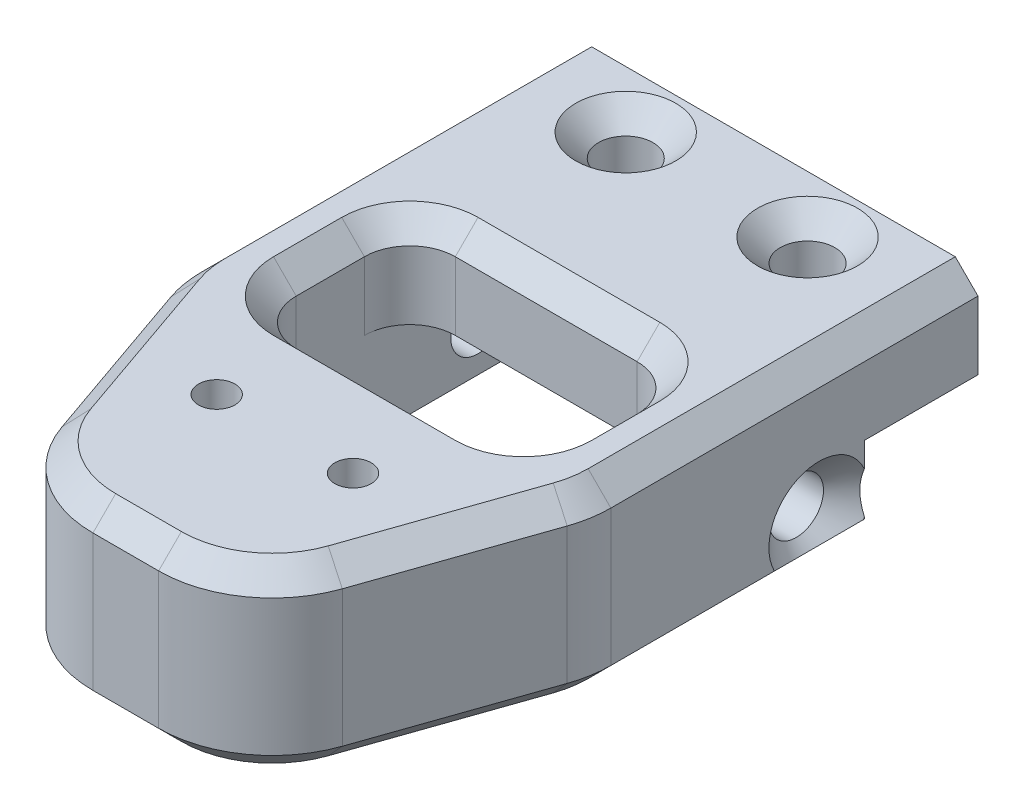
from build123d import *

# Parameters (mm, degrees)
ESBO_O1_W                                            = 18
ESBO_O1_H                                            = 28.5
RESSALTO_EXTRUS_O1_DEPTH                             = 8
ESCAREADO_PARA_PARAFUSO_COM_CABE_A_ESCAR_D           = 2.4
ESCAREADO_PARA_PARAFUSO_COM_CABE_A_ESCAR_CSINK_D     = 4.4
ESCAREADO_PARA_PARAFUSO_COM_CABE_A_ESCAR_CSINK_ANGLE = 90
CORTE_EXTRUS_O1_DEPTH                                = 4
ESCAREADO_PARA_PARAFUSO_COM_CABE_A_E_3_D             = 2.4
ESCAREADO_PARA_PARAFUSO_COM_CABE_A_E_3_CSINK_D       = 4.4
ESCAREADO_PARA_PARAFUSO_COM_CABE_A_E_3_CSINK_ANGLE   = 90
CORTE_EXTRUS_O2_DEPTH                                = 35.644624403
FILETE1_R                                            = 5
CHANFRO1_SIZE                                        = 1
CHANFRO2_SIZE                                        = 1
BROCA_DE_ROSQUEAR_PARA_TARRAXA_DE_M21_D              = 1.6


# Read off the part's stored shape, not the designer's step: Escareado para parafuso com cabeça escareada chata de M21
with BuildPart() as part:
    # Esboço1 → Ressalto-extrusão1 (new body)
    with BuildSketch(Plane(origin=(0, 0, 0), x_dir=(1, 0, 0), z_dir=(0, 1, 0))):
        with Locations((9, 14.25)):
            Rectangle(ESBO_O1_W, ESBO_O1_H)
        with BuildLine():
            Line((5, 11.5), (13, 11.5))
            ThreePointArc((13, 11.5), (14.414213562, 12.085786438), (15, 13.5))
            Line((15, 13.5), (15, 16.5))
            ThreePointArc((15, 16.5), (14.414213562, 17.914213562), (13, 18.5))
            Line((13, 18.5), (5, 18.5))
            ThreePointArc((5, 18.5), (3.585786438, 17.914213562), (3, 16.5))
            Line((3, 16.5), (3, 13.5))
            ThreePointArc((3, 13.5), (3.585786438, 12.085786438), (5, 11.5))
        make_face(mode=Mode.SUBTRACT)
    extrude(amount=RESSALTO_EXTRUS_O1_DEPTH)

    # Escareado para parafuso com cabe_a escar (through all)
    with Locations(Plane(origin=(5, 8, -26), x_dir=(0, 0, 1), z_dir=(0, 1, 0))):
        with Locations((0, 0), (0, 8)):
            CounterSinkHole(ESCAREADO_PARA_PARAFUSO_COM_CABE_A_ESCAR_D / 2, ESCAREADO_PARA_PARAFUSO_COM_CABE_A_ESCAR_CSINK_D / 2, counter_sink_angle=ESCAREADO_PARA_PARAFUSO_COM_CABE_A_ESCAR_CSINK_ANGLE)

    # Esboço10 → Corte-extrusão1 (cut)
    with BuildSketch(Plane.XZ):
        Polygon((0, -28.5), (18, -28.5), (18, -23.5), (15, -23.5), (15, -15), (3, -15), (3, -23.5), (0, -23.5), align=None)
    extrude(amount=-CORTE_EXTRUS_O1_DEPTH, mode=Mode.SUBTRACT)

    # Escareado para parafuso com cabe_a e 2 o → Escareado para parafuso com cabe_a e 2 (revolve, cut)
    with BuildSketch(Plane(origin=(0, 2, -21.5), x_dir=(0, 1, 0), z_dir=(0, 0, -1))):
        Polygon((2.2, 18), (0, 18), (0, 15), (1.2, 15), (1.2, 17), align=None)
    revolve(axis=Axis((0, 2, -21.5), (1, 0, 0)), mode=Mode.SUBTRACT)

    # Escareado para parafuso com cabe_a e 3 (through all)
    with Locations(Plane(origin=(0, 2, -21.5), x_dir=(0, 0, -1), z_dir=(-1, 0, 0))):
        with Locations((0, 0)):
            CounterSinkHole(ESCAREADO_PARA_PARAFUSO_COM_CABE_A_E_3_D / 2, ESCAREADO_PARA_PARAFUSO_COM_CABE_A_E_3_CSINK_D / 2, counter_sink_angle=ESCAREADO_PARA_PARAFUSO_COM_CABE_A_E_3_CSINK_ANGLE)

    # Esboço15 → Corte-extrusão2 (cut, through all)
    with BuildSketch(Plane(origin=(0, 8, 0), x_dir=(1, 0, 0), z_dir=(0, 1, 0))):
        Polygon((0, 0), (4, 0), (0, 11.5), align=None)
        Polygon((18, 0), (18, 11.5), (14, 0), align=None)
    extrude(amount=-CORTE_EXTRUS_O2_DEPTH, mode=Mode.SUBTRACT)

    # Filete1
    filete1_edges = [part.edges().sort_by_distance(p)[0] for p in [
        (0, 4, -11.5),
        (4, 4, 0),
        (14, 4, 0),
        (18, 4, -11.5),
    ]]
    fillet(filete1_edges, radius=FILETE1_R)

    # Chanfro1
    chanfro1_edges = [part.edges().sort_by_distance(p)[0] for p in [
        (16.445137101, 8, -7.029769164),
        (0, 8, -20.422372289),
        (1.554862899, 8, -7.029769164),
        (9, 8, 0),
        (18, 8, -20.422372289),
        (13.342458661, 8, -0.924891681),
        (0.069867146, 8, -11.511803979),
        (4.657541339, 8, -0.924891681),
        (17.930132854, 8, -11.511803979),
        (3.585786438, 8, -12.085786438),
        (14.414213562, 8, -17.914213562),
        (9, 8, -18.5),
        (3.585786438, 8, -17.914213562),
        (3, 8, -15),
        (9, 8, -11.5),
        (14.414213562, 8, -12.085786438),
        (15, 8, -15),
    ]]
    chamfer(chanfro1_edges, length=CHANFRO1_SIZE)

    # Chanfro2
    # the kernel refuses this chamfer: 1 mm, written as the material it takes off along each edge
    with BuildSketch(Plane(origin=(0, 0, -26.071682988), x_dir=(0.9996219169112968, -0.027495876610586372, 0), z_dir=(0, 0, 1)), Plane(origin=(18, 0, -19.844832151), x_dir=(-0.9996219169112968, -0.02749587661058639, 0), z_dir=(0, 0, -1))) as chanfro2_piece_1:
        Polygon((CHANFRO2_SIZE * 0.999621916911, CHANFRO2_SIZE * 0.0274958766106), (-CHANFRO2_SIZE * 0.0274958766106, CHANFRO2_SIZE * 0.999621916911), (0, 0), align=None)
    extrude(amount=6.226850837, mode=Mode.SUBTRACT)
    with BuildSketch(Plane(origin=(17.722483984, 0, -10.702141453), x_dir=(-0.94413969843999, -0.02749587661058639, -0.32839641684869236), z_dir=(-0.3285206249412729, 0, 0.944496796706159)), Plane(origin=(2.832209783, 0, -3.357396875), x_dir=(0.9441396984399901, -0.02749587661058552, -0.32839641684869225), z_dir=(-0.32852062494127277, 0, -0.9444967967061592))) as chanfro2_piece_2:
        Polygon((CHANFRO2_SIZE * 0.999621916911, -CHANFRO2_SIZE * 0.0274958766106), (-CHANFRO2_SIZE * 0.0274958766106, -CHANFRO2_SIZE * 0.999621916911), (0, 0), align=None)
    extrude(amount=7.776357318, mode=Mode.SUBTRACT)
    with BuildSketch(Plane(origin=(18, 0, -12.344744577), x_dir=(-0.9996219169112968, -0.02749587661058639, 0), z_dir=(0, 0, -1)), Plane(origin=(0, 0, -23.155167849), x_dir=(0.9996219169112968, -0.027495876610586372, 0), z_dir=(0, 0, 1))) as chanfro2_piece_3:
        Polygon((CHANFRO2_SIZE * 0.999621916911, CHANFRO2_SIZE * 0.0274958766106), (-CHANFRO2_SIZE * 0.0274958766106, CHANFRO2_SIZE * 0.999621916911), (0, 0), align=None)
    extrude(amount=10.810423272, mode=Mode.SUBTRACT)
    with BuildSketch(Plane(origin=(7.554693766, 0, 0), x_dir=(0, 0.9996219169112968, 0.027495876610586372), z_dir=(1, 0, 0))) as chanfro2_piece_4:
        Polygon((CHANFRO2_SIZE * 0.999621916911, -CHANFRO2_SIZE * 0.0274958766106), (-CHANFRO2_SIZE * 0.0274958766106, -CHANFRO2_SIZE * 0.999621916911), (0, 0), align=None)
    extrude(amount=2.890612468, mode=Mode.SUBTRACT)
    with BuildSketch(Plane(origin=(10.445306234, 0, -5), x_dir=(0, 0, 1), z_dir=(-1, 0, 0))) as chanfro2_piece_5:
        Polygon((5 - CHANFRO2_SIZE, 0), (5, CHANFRO2_SIZE), (5, 0), align=None)
    revolve(axis=Axis((10.445306234, 0, -5), (0, 1, 0)), revolution_arc=70.820991974, mode=Mode.SUBTRACT)
    with BuildSketch(Plane(origin=(5, 0, -12.344744577), x_dir=(-0.944496796706159, 0, 0.32852062494127277), z_dir=(0.32852062494127277, 0, 0.944496796706159))) as chanfro2_piece_6:
        Polygon((5 - CHANFRO2_SIZE, 0), (5, -CHANFRO2_SIZE), (5, 0), align=None)
    revolve(axis=Axis((5, 0, -12.344744577), (0, -1, 0)), revolution_arc=19.179008026, mode=Mode.SUBTRACT)
    with BuildSketch(Plane(origin=(7.554693766, 0, -5), x_dir=(0, 0, 1), z_dir=(1, 0, 0))) as chanfro2_piece_7:
        Polygon((5, -CHANFRO2_SIZE), (5 - CHANFRO2_SIZE, 0), (5, 0), align=None)
    revolve(axis=Axis((7.554693766, 0, -5), (0, -1, 0)), revolution_arc=70.820991974, mode=Mode.SUBTRACT)
    with BuildSketch(Plane(origin=(13, 0, -12.344744577), x_dir=(0.9444967967061589, 0, 0.3285206249412729), z_dir=(-0.3285206249412729, 0, 0.9444967967061589))) as chanfro2_piece_8:
        Polygon((5 - CHANFRO2_SIZE, 0), (5, CHANFRO2_SIZE), (5, 0), align=None)
    revolve(axis=Axis((13, 0, -12.344744577), (0, 1, 0)), revolution_arc=19.179008026, mode=Mode.SUBTRACT)

    # Broca de rosquear para tarraxa de M21 (through all)
    with Locations(Plane(origin=(6, 8, -7), x_dir=(0, 0, 1), z_dir=(0, 1, 0))):
        with Locations((0, 0), (0, 6)):
            Hole(BROCA_DE_ROSQUEAR_PARA_TARRAXA_DE_M21_D / 2)


solid = part.part
